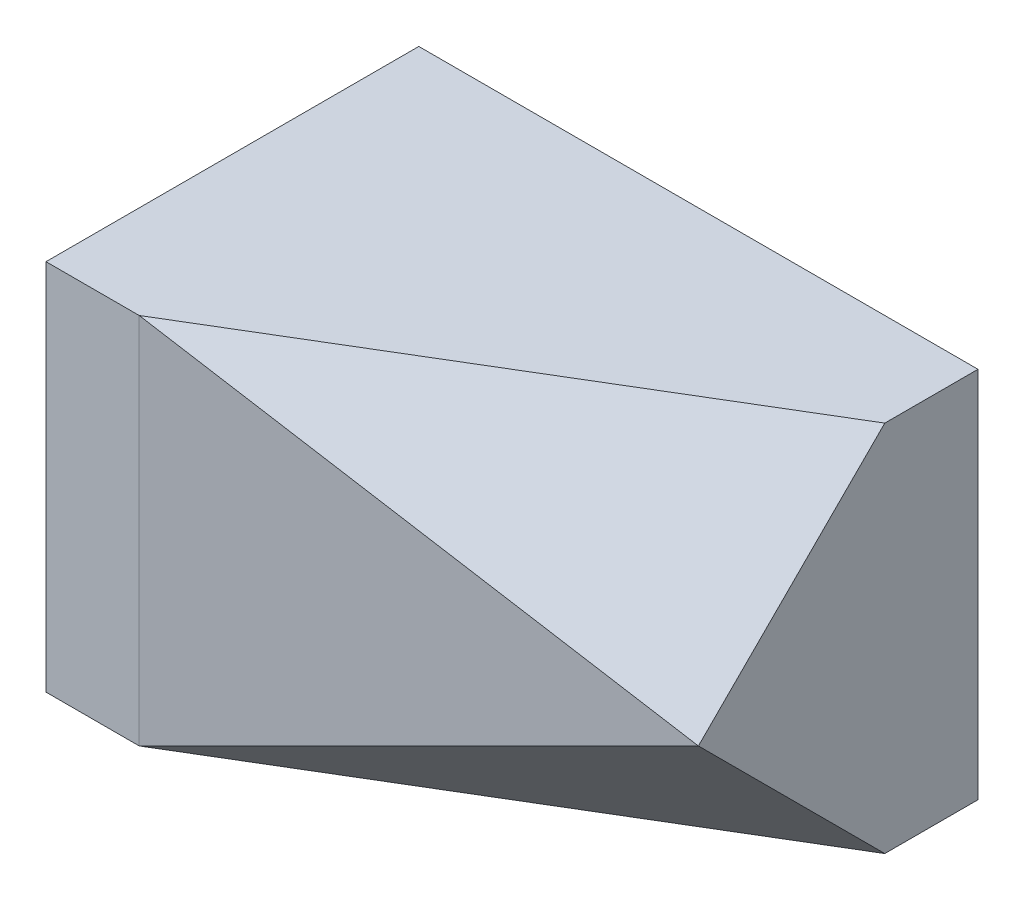
from build123d import *

# Parameters (mm, degrees)
SKETCH_1_W              = 6
SKETCH_1_H              = 4
EXTRUDE_1_DEPTH         = 4
CUT_EXTRUDE_2_DEPTH     = 4
CUT_EXTRUDE_START       = 2.994344953
CUT_EXTRUDE_3_OUTLINE_W = 9
CUT_EXTRUDE_3_OUTLINE_H = 5
CUT_EXTRUDE_3_DEPTH     = 1.301889109
CUT_EXTRUDE_4_DEPTH     = 4


with BuildPart() as part:
    # 草圖1 → 填料-伸長1 (new body)
    with BuildSketch(Plane(origin=(0, 0, 0), x_dir=(1, 0, 0), z_dir=(0, 1, 0))):
        with Locations((3, 2)):
            Rectangle(SKETCH_1_W, SKETCH_1_H)
    extrude(amount=EXTRUDE_1_DEPTH)

    # 草圖3 → 除料-伸長2 (cut)
    with BuildSketch(Plane(origin=(0, 4, 0), x_dir=(1, 0, 0), z_dir=(0, 1, 0))):
        Polygon((6, 0), (6, 1), (1, 0), align=None)
    extrude(amount=-CUT_EXTRUDE_2_DEPTH, mode=Mode.SUBTRACT)

    # 除料-伸長3: read off the stored shape, not the designer's step
    # 除料-伸長3 outline → 除料-伸長3 (cut)
    with BuildSketch(Plane(origin=(0, 0, 0), x_dir=(0.9205746178983235, -0.27617238536949684, -0.27617238536949684), z_dir=(0.3905667329424713, 0.6509445549041195, 0.6509445549041195)).offset(CUT_EXTRUDE_START)):
        with Locations((2.5, 3.5)):
            Rectangle(CUT_EXTRUDE_3_OUTLINE_W, CUT_EXTRUDE_3_OUTLINE_H)
    extrude(amount=CUT_EXTRUDE_3_DEPTH, mode=Mode.SUBTRACT)

    # Sketch 3D_4 → 除料-伸長4 (cut, along a direction that is not the sketch's normal)
    with BuildSketch(Plane(origin=(1, 0, 0), x_dir=(0.8574929257125423, 0, -0.5144957554275298), z_dir=(0.39056673294247424, -0.6509445549041188, 0.6509445549041183))):
        Polygon((0, 0), (4.801960384, 2.634611256), (5.830951895, 0), align=None)
    extrude(amount=CUT_EXTRUDE_4_DEPTH, dir=(0.19611613513818402, 0, 0.9805806756909202), mode=Mode.SUBTRACT)


solid = part.part
